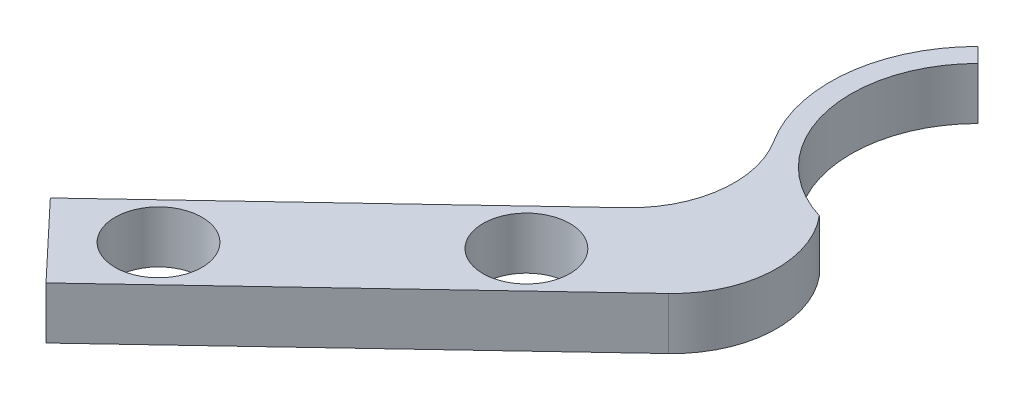
from build123d import *

# Parameters (mm, degrees)
SKETCH_1_R       = 4.175
EXTRUDE_1_DEPTH  = 5
FILLET_1_DEPTH   = 5
FILLET_1_2_DEPTH = 5


with BuildPart() as part:
    # ｽｹｯﾁ1 → ﾎﾞｽ - 押し出し1 (new body)
    # profile 1 of 4: a face of its own
    with BuildSketch(Plane(origin=(0, 0, 0), x_dir=(1, 0, 0), z_dir=(0, 1, 0))):
        Polygon((21.537147831, 13.436802865), (14.676517829, 20.712224225), (-21.537147831, -13.436802865), (-14.676517829, -20.712224225), align=None)
        with Locations(Location((-12.65026681, -11.929041043, 0), (0, 0, 270))):
            Circle(SKETCH_1_R, mode=Mode.SUBTRACT)
        with Locations(Location((5.538286591, 5.222533963, 0), (0, 0, 270))):
            Circle(SKETCH_1_R, mode=Mode.SUBTRACT)
    # profile 2 of 4: a face of its own
    with BuildSketch(Plane(origin=(0, 0, 0), x_dir=(1, 0, 0), z_dir=(0, 1, 0))):
        Polygon((21.537147831, 13.436802865), (-14.676517829, -20.712224225), (-21.537147831, -13.436802865), (14.676517829, 20.712224225), align=None)
        with Locations(Location((5.538286591, 5.222533963, 0), (0, 0, 270))):
            Circle(SKETCH_1_R, mode=Mode.SUBTRACT)
        with Locations(Location((-12.65026681, -11.929041043, 0), (0, 0, 270))):
            Circle(SKETCH_1_R, mode=Mode.SUBTRACT)
    # profile 3 of 4: a face of its own
    with BuildSketch(Plane(origin=(0, 0, 0), x_dir=(1, 0, 0), z_dir=(0, 1, 0))):
        with BuildLine():
            ThreePointArc((19.221377033, 19.536564594), (16.900027476, 19.935279891), (14.676517829, 20.712224225))
            Line((14.676517829, 20.712224225), (21.537147831, 13.436802865))
            ThreePointArc((21.537147831, 13.436802865), (22.425633577, 14.316933157), (23.303261531, 15.207890747))
            Line((23.303261531, 15.207890747), (19.221377033, 19.536564594))
        make_face()
    # profile 4 of 4: a face of its own
    with BuildSketch(Plane(origin=(0, 0, 0), x_dir=(1, 0, 0), z_dir=(0, 1, 0))):
        with BuildLine():
            ThreePointArc((10.415298606, 43.723687992), (6.493592725, 31.097199803), (14.676517829, 20.712224225))
            ThreePointArc((14.676517829, 20.712224225), (16.900027476, 19.935279891), (19.221377033, 19.536564594))
            Line((19.221377033, 19.536564594), (16.881068514, 22.018367371))
            ThreePointArc((16.881068514, 22.018367371), (8.617568994, 30.735491067), (11.829512169, 42.309474429))
            Line((11.829512169, 42.309474429), (10.415298606, 43.723687992))
        make_face()
    extrude(amount=EXTRUDE_1_DEPTH)

    # ﾌｨﾚｯﾄ1: read off the stored shape, not the designer's step
    # ﾌｨﾚｯﾄ1 outline → ﾌｨﾚｯﾄ1 (cut)
    with BuildSketch(Plane(origin=(0, 0, 0), x_dir=(1, 0, 0), z_dir=(0, 1, 0))):
        with BuildLine():
            Line((23.303261531, 15.207890747), (16.881068514, 22.018367371))
            ThreePointArc((16.881068514, 22.018367371), (19.214955148, 15.00333268), (16.092088027, 8.302180578))
            Line((16.092088027, 8.302180578), (21.537147831, 13.436802865))
            ThreePointArc((21.537147831, 13.436802865), (22.425633577, 14.316933157), (23.303261531, 15.207890747))
        make_face()
    extrude(amount=FILLET_1_DEPTH, mode=Mode.SUBTRACT)

    # Fillet 1 2 outline → Fillet 1 2 (add)
    with BuildSketch(Plane(origin=(0, 0, 0), x_dir=(1, 0, 0), z_dir=(0, 1, 0))):
        with BuildLine():
            ThreePointArc((14.676517829, 20.712224225), (11.188521166, 22.924061141), (8.484552975, 26.046063588))
            ThreePointArc((8.484552975, 26.046063588), (9.977695299, 19.436676513), (6.914435143, 13.39267877))
            Line((6.914435143, 13.39267877), (14.676517829, 20.712224225))
        make_face()
    extrude(amount=FILLET_1_2_DEPTH)


solid = part.part
